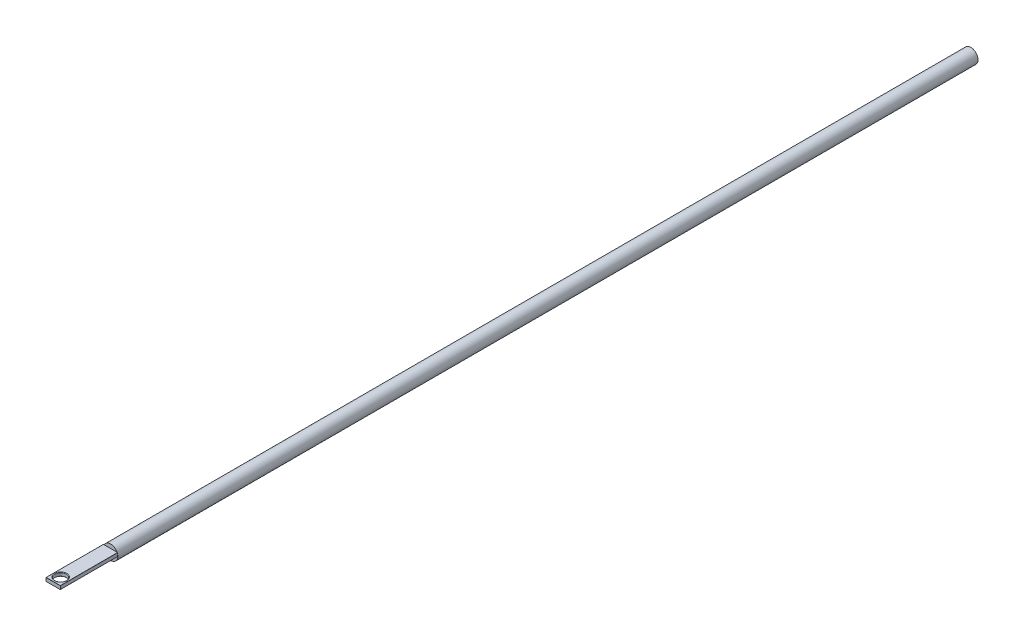
from build123d import *

# Parameters (mm, degrees)
SKETCH1_R           = 6.25
BOSS_EXTRUDE1_DEPTH = 750
SKETCH9_W           = 12.5
SKETCH9_H           = 50
SKETCH9_R           = 5
BOSS_EXTRUDE5_DEPTH = 3
FILLET3_R           = 0.1
FILLET5_R           = 0.5


with BuildPart() as part:
    # Sketch1 → Boss-Extrude1 (new body)
    with BuildSketch(Plane.XY):
        Circle(SKETCH1_R)
    extrude(amount=BOSS_EXTRUDE1_DEPTH)


with BuildPart() as body_2:
    # Sketch9 → Boss-Extrude5 (new body)
    with BuildSketch(Plane(origin=(0, 0, 0), x_dir=(1, 0, 0), z_dir=(0, 1, 0))):
        with Locations((0.06367686, -775.197871661)):
            Rectangle(SKETCH9_W, SKETCH9_H)
        with Locations((-0.088854364, -793.497307476)):
            Circle(SKETCH9_R, mode=Mode.SUBTRACT)
    extrude(amount=BOSS_EXTRUDE5_DEPTH)

    # Fillet3
    fillet3_edges = [body_2.edges().sort_by_distance(p)[0] for p in [
        (-5.088854364, 0, 793.497307476),
        (0.06367686, 3, 800.197871661),
        (6.31367686, 0, 775.197871661),
        (-6.18632314, 0, 775.197871661),
        (6.31367686, 3, 775.197871661),
        (-6.18632314, 3, 775.197871661),
    ]]
    fillet(fillet3_edges, radius=FILLET3_R)

    # Fillet5
    fillet5_edges = [body_2.edges().sort_by_distance(p)[0] for p in [
        (-5.088854364, 3, 793.497307476),
    ]]
    fillet(fillet5_edges, radius=FILLET5_R)


solid = Compound([part.part, body_2.part])
